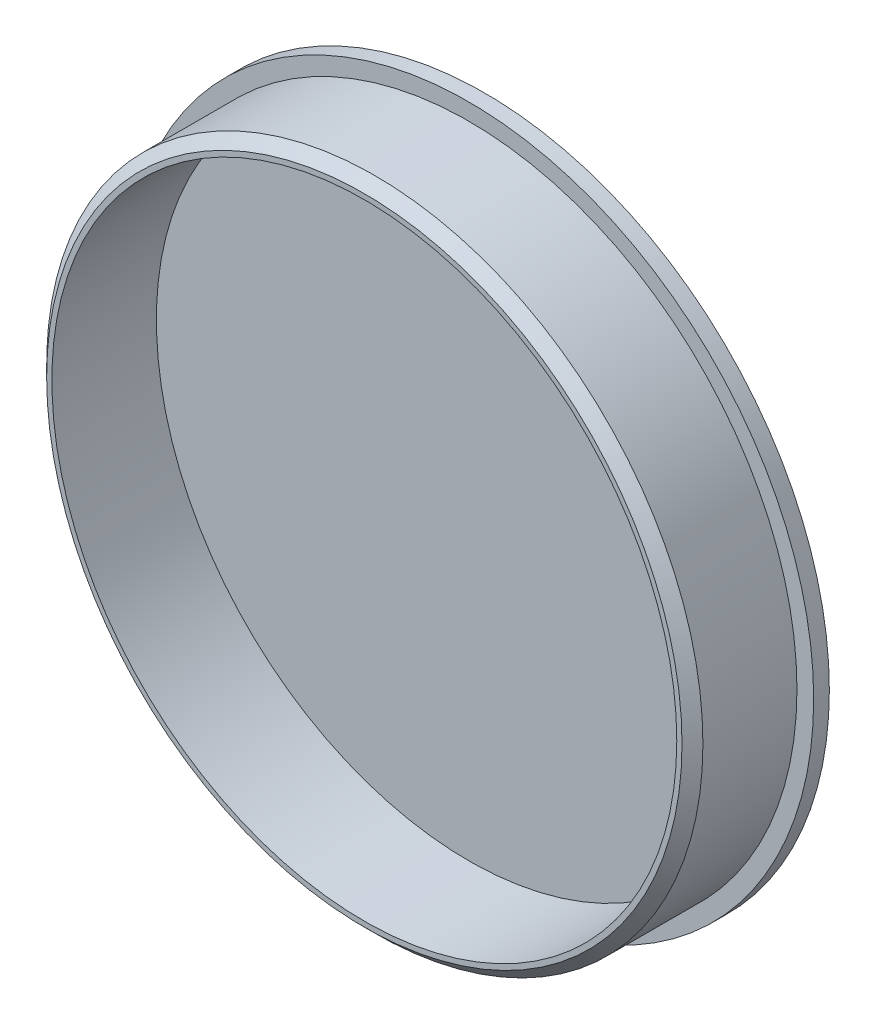
from build123d import *

# Parameters (mm, degrees)
SKETCH1_R               = 33
BOSS_EXTRUDE1_DEPTH     = 46.75
CUT_EXTRUDE1_DEPTH      = 10
CUT_EXTRUDE1_DEPTH_BACK = 114.313999576
SKETCH11_R              = 2.1
CIRPATTERN1_COUNT       = 4
SKETCH12_R              = 5
BOSS_EXTRUDE5_DEPTH     = 54
CUT_EXTRUDE2_DEPTH      = 128.126167645
CUT_EXTRUDE2_DEPTH_BACK = 128.126167645
SKETCH13_R              = 1.5
CUT_EXTRUDE6_START      = -1.5
SKETCH18_R              = 51.991870464
CUT_EXTRUDE6_DEPTH      = 170.973030046
SKETCH19_R              = 31.4
BOSS_EXTRUDE10_DEPTH    = 10
SHELL2_T                = -1.5
CHAMFER2_SIZE           = 1


with BuildPart() as part:
    # Sketch1 → Boss-Extrude1 (new, symmetric)
    with BuildSketch(Plane.XY):
        Circle(SKETCH1_R)
    extrude(amount=BOSS_EXTRUDE1_DEPTH, both=True)

    # Sketch10 → Revolve1 (revolve)
    with BuildSketch(Plane(origin=(0, 0, 0), x_dir=(0, 0, -1), z_dir=(1, 0, 0))):
        Polygon((-64.25, 0), (-64.25, 15), (-46.75, 33), (-46.75, 0), align=None)
    revolve(axis=Axis((0, 0, 1000), (0, 0, -1)))

    # Sketch11 → Cut-Extrude1 (cut, two sides: drawn at the far end of the back side and taken through both)
    with BuildSketch(Plane(origin=(-33, 33, 0), x_dir=(0, 0, -1), z_dir=(0, -1, 0)).offset(-CUT_EXTRUDE1_DEPTH_BACK)):
        with Locations((-44.25, 33)):
            Circle(SKETCH11_R)
    extrude(amount=CUT_EXTRUDE1_DEPTH + CUT_EXTRUDE1_DEPTH_BACK, mode=Mode.SUBTRACT)

    # CirPattern1: part ×4 about axis
    cirpattern1_axis = Axis((0, 0, 0), (0, 0, 1))


with BuildPart() as part_1:
    add(part.part)
    for i in range(1, CIRPATTERN1_COUNT):
        add(part.part.rotate(cirpattern1_axis, i * 360 / CIRPATTERN1_COUNT))

    # Sketch12 → Boss-Extrude5 (add)
    with BuildSketch(Plane.XY.offset(64.25)):
        Circle(SKETCH12_R)
    extrude(amount=BOSS_EXTRUDE5_DEPTH)

    # Sketch13 → Cut-Extrude2 (cut, two sides: drawn at the far end of the back side and taken through both)
    with BuildSketch(Plane(origin=(0, 0, 0), x_dir=(0, 0, -1), z_dir=(1, 0, 0)).offset(-CUT_EXTRUDE2_DEPTH_BACK)):
        with Locations((-79.25, 0)):
            Circle(SKETCH13_R)
    extrude(amount=CUT_EXTRUDE2_DEPTH + CUT_EXTRUDE2_DEPTH_BACK, mode=Mode.SUBTRACT)

    # Sketch14 one side → Cut-Revolve1 (revolve, cut)
    with BuildSketch(Plane(origin=(0, 0, 0), x_dir=(0, 0, -1), z_dir=(1, 0, 0))):
        with BuildLine():
            ThreePointArc((-112, 5), (-111.25, 4.25), (-110.5, 5))
            Line((-110.5, 5), (-112, 5))
        make_face()
    revolve(axis=Axis((0, 5, 64.25), (0, 0, 1)), mode=Mode.SUBTRACT)

    # Sketch18 → Cut-Extrude6 (cut, through all)
    with BuildSketch(Plane(origin=(0, 0, -46.75), x_dir=(-1, 0, 0), z_dir=(0, 0, -1)).offset(CUT_EXTRUDE6_START)):
        Circle(SKETCH18_R)
    extrude(amount=-CUT_EXTRUDE6_DEPTH, mode=Mode.SUBTRACT)

    # Sketch19 → Boss-Extrude10 (add)
    with BuildSketch(Plane.XY.offset(-45.25)):
        Circle(SKETCH19_R)
    extrude(amount=BOSS_EXTRUDE10_DEPTH)

    # Shell2
    shell2_openings = [part_1.faces().sort_by_distance(p)[0] for p in [
        (0, 0, -35.25),
    ]]
    offset(amount=SHELL2_T, openings=shell2_openings, kind=Kind.INTERSECTION)

    # Chamfer2
    chamfer2_edges = [part_1.edges().sort_by_distance(p)[0] for p in [
        (-31.4, 0, -35.25),
    ]]
    chamfer(chamfer2_edges, length=CHAMFER2_SIZE)


solid = part_1.part
